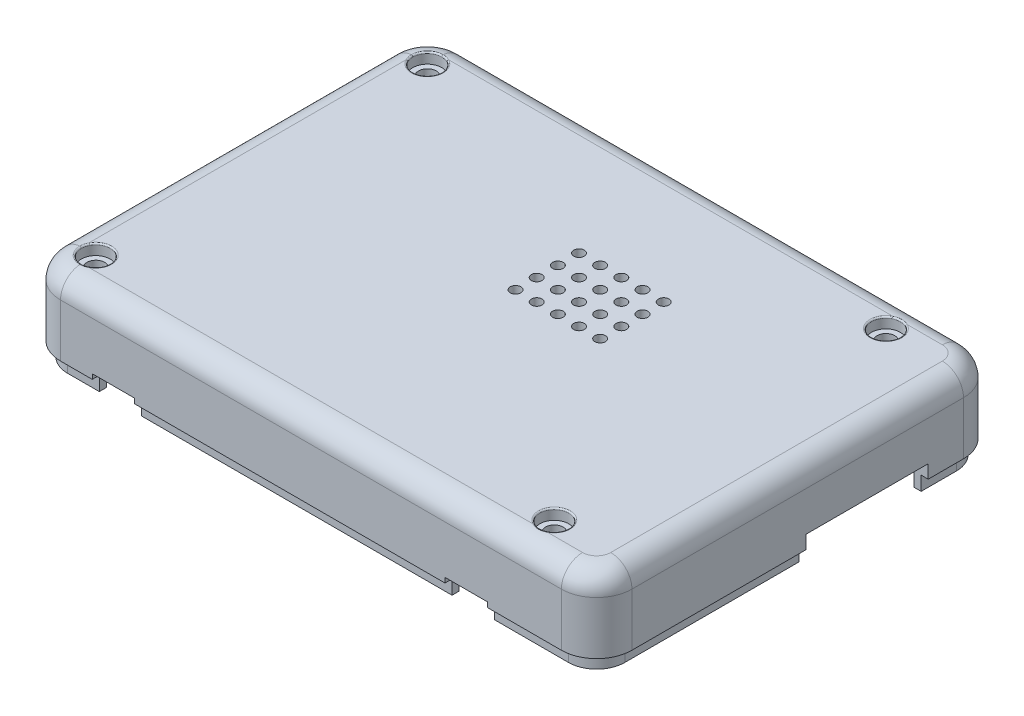
from build123d import *

# Parameters (mm, degrees)
SKETCH_4_W          = 81
SKETCH_4_H          = 57
SKETCH_4_R          = 1.25
EXTRUDE_5_DEPTH     = 3
EXTRUDE_START       = -3
SKETCH_4_4_R        = 2.5
SKETCH_4_4_R_2      = 1.25
EXTRUDE_6_DEPTH     = 10.6
SKETCH_4_5_W        = 81
SKETCH_4_5_H        = 57
SKETCH_4_5_W_2      = 77
SKETCH_4_5_H_2      = 53
EXTRUDE_7_DEPTH     = 10.5
SKETCH_6_W          = 12.5
SKETCH_6_H          = 2.15
SKETCH_6_W_2        = 10
SKETCH_6_W_3        = 7.5
SKETCH_6_H_2        = 3.15
SKETCH_6_W_4        = 9
SKETCH_6_H_3        = 0.5
CUT_EXTRUDE_1_DEPTH = 2
SKETCH_7_W          = 10.9
SKETCH_7_H          = 1.2
SKETCH_7_W_2        = 8.95
SKETCH_7_H_2        = 7.5
CUT_EXTRUDE_2_DEPTH = 2
SKETCH_8_W          = 6
SKETCH_8_H          = 0.7
CUT_EXTRUDE_3_DEPTH = 2
SKETCH_9_W          = 17.3
SKETCH_9_H          = 1.9
CUT_EXTRUDE_4_DEPTH = 2
FILLET_2_R          = 3
FILLET_3_R          = 5
FILLET_4_R          = 3
FILLET_5_R          = 2
FILLET_6_R          = 3.5
SKETCH_10_R         = 2.05
CUT_EXTRUDE_5_DEPTH = 1.5
FILLET_7_R          = 0.2
EXTRUDE_START_2     = 2
SKETCH_12_W         = 3.4
SKETCH_12_H         = 1
SKETCH_12_W_2       = 4
SKETCH_12_W_3       = 7
SKETCH_12_W_4       = 1
SKETCH_12_H_2       = 17.85
SKETCH_12_W_5       = 44
EXTRUDE_9_DEPTH     = 2
SKETCH_13_R         = 0.75
CUT_EXTRUDE_6_DEPTH = 3


# Some blends are built 0.0001 mm under size
with BuildPart() as part:
    # 草图4 → 凸台-拉伸5 (new body)
    with BuildSketch(Plane(origin=(0, 0, 0), x_dir=(1, 0, 0), z_dir=(0, 1, 0))):
        with Locations((-80.045972017, 113.056664423)):
            Rectangle(SKETCH_4_W, SKETCH_4_H)
        with Locations(Location((-115.545972017, 136.556664423, 0), (0, 0, 270))):
            Circle(SKETCH_4_R, mode=Mode.SUBTRACT)
        with Locations(Location((-50.545972017, 136.556664423, 0), (0, 0, 270))):
            Circle(SKETCH_4_R, mode=Mode.SUBTRACT)
        with Locations(Location((-50.545972017, 89.556664423, 0), (0, 0, 270))):
            Circle(SKETCH_4_R, mode=Mode.SUBTRACT)
        with Locations(Location((-115.545972017, 89.556664423, 0), (0, 0, 270))):
            Circle(SKETCH_4_R, mode=Mode.SUBTRACT)
    extrude(amount=-EXTRUDE_5_DEPTH)

    # 草图4<4> → 凸台-拉伸6 (add)
    # profile 1 of 4: a face of its own
    with BuildSketch(Plane(origin=(0, 0, 0), x_dir=(1, 0, 0), z_dir=(0, 1, 0)).offset(EXTRUDE_START)):
        with Locations(Location((-50.545972017, 89.556664423, 0), (0, 0, 90))):
            Circle(SKETCH_4_4_R)
        with Locations(Location((-50.545972017, 89.556664423, 0), (0, 0, 270))):
            Circle(SKETCH_4_4_R_2, mode=Mode.SUBTRACT)
    # profile 2 of 4: a face of its own
    with BuildSketch(Plane(origin=(0, 0, 0), x_dir=(1, 0, 0), z_dir=(0, 1, 0)).offset(EXTRUDE_START)):
        with Locations(Location((-115.545972017, 89.556664423, 0), (0, 0, 90))):
            Circle(SKETCH_4_4_R)
        with Locations(Location((-115.545972017, 89.556664423, 0), (0, 0, 270))):
            Circle(SKETCH_4_4_R_2, mode=Mode.SUBTRACT)
    # profile 3 of 4: a face of its own
    with BuildSketch(Plane(origin=(0, 0, 0), x_dir=(1, 0, 0), z_dir=(0, 1, 0)).offset(EXTRUDE_START)):
        with Locations(Location((-50.545972017, 136.556664423, 0), (0, 0, 90))):
            Circle(SKETCH_4_4_R)
        with Locations(Location((-50.545972017, 136.556664423, 0), (0, 0, 270))):
            Circle(SKETCH_4_4_R_2, mode=Mode.SUBTRACT)
    # profile 4 of 4: a face of its own
    with BuildSketch(Plane(origin=(0, 0, 0), x_dir=(1, 0, 0), z_dir=(0, 1, 0)).offset(EXTRUDE_START)):
        with Locations(Location((-115.545972017, 136.556664423, 0), (0, 0, 90))):
            Circle(SKETCH_4_4_R)
        with Locations(Location((-115.545972017, 136.556664423, 0), (0, 0, 270))):
            Circle(SKETCH_4_4_R_2, mode=Mode.SUBTRACT)
    extrude(amount=-EXTRUDE_6_DEPTH)

    # 草图4<5> → 凸台-拉伸7 (add)
    with BuildSketch(Plane(origin=(0, 0, 0), x_dir=(1, 0, 0), z_dir=(0, 1, 0))):
        with Locations((-80.045972017, 113.056664423)):
            Rectangle(SKETCH_4_5_W, SKETCH_4_5_H)
        with Locations((-80.045972017, 113.056664423)):
            Rectangle(SKETCH_4_5_W_2, SKETCH_4_5_H_2, mode=Mode.SUBTRACT)
    extrude(amount=-EXTRUDE_7_DEPTH)

    # 草图6 → 切除-拉伸1 (cut)
    with BuildSketch(Plane(origin=(0, 0, -141.556664423), x_dir=(-1, 0, 0), z_dir=(0, 0, -1))):
        with Locations((65.795972017, -9.425)):
            Rectangle(SKETCH_6_W, SKETCH_6_H)
        with Locations((80.445972017, -9.425)):
            Rectangle(SKETCH_6_W_2, SKETCH_6_H)
        with Locations((93.195972017, -8.925)):
            Rectangle(SKETCH_6_W_3, SKETCH_6_H_2)
        with Locations((108.445972017, -10.25)):
            Rectangle(SKETCH_6_W_4, SKETCH_6_H_3)
    extrude(amount=-CUT_EXTRUDE_1_DEPTH, mode=Mode.SUBTRACT)

    # 草图7 → 切除-拉伸2 (cut)
    with BuildSketch(Plane.ZY.offset(120.545972017)):
        with Locations((-101.006664423, -9.9)):
            Rectangle(SKETCH_7_W, SKETCH_7_H)
        with Locations((-128.781664423, -6.75)):
            Rectangle(SKETCH_7_W_2, SKETCH_7_H_2)
    extrude(amount=-CUT_EXTRUDE_2_DEPTH, mode=Mode.SUBTRACT)

    # 草图8 → 切除-拉伸3 (cut)
    with BuildSketch(Plane.XY.offset(-84.556664423)):
        with Locations((-108.045972017, -10.15)):
            Rectangle(SKETCH_8_W, SKETCH_8_H)
        with Locations((-58.045972017, -10.15)):
            Rectangle(SKETCH_8_W, SKETCH_8_H)
    extrude(amount=-CUT_EXTRUDE_3_DEPTH, mode=Mode.SUBTRACT)

    # 草图9 → 切除-拉伸4 (cut)
    with BuildSketch(Plane(origin=(-39.545972017, 0, 0), x_dir=(0, 0, -1), z_dir=(1, 0, 0))):
        with Locations((122.906664423, -9.55)):
            Rectangle(SKETCH_9_W, SKETCH_9_H)
    extrude(amount=-CUT_EXTRUDE_4_DEPTH, mode=Mode.SUBTRACT)

    # 圆角2
    fillet_2_edges = [part.edges().sort_by_distance(p)[0] for p in [
        (-41.545972017, -6.75, -139.556664423),
        (-118.545972017, -6.75, -139.556664423),
        (-118.545972017, -6.75, -86.556664423),
        (-41.545972017, -6.75, -86.556664423),
    ]]
    fillet(fillet_2_edges, radius=FILLET_2_R)

    # 圆角3
    fillet_3_edges = [part.edges().sort_by_distance(p)[0] for p in [
        (-120.545972017, -5.25, -141.556664423),
        (-120.545972017, -5.25, -84.556664423),
        (-39.545972017, -5.25, -84.556664423),
        (-39.545972017, -5.25, -141.556664423),
    ]]
    fillet(fillet_3_edges, radius=FILLET_3_R)

    # 圆角4
    fillet_4_edges = [part.edges().sort_by_distance(p)[0] for p in [
        (-120.545972017, 0, -113.056664423),
        (-80.045972017, 0, -141.556664423),
        (-80.045972017, 0, -84.556664423),
        (-39.545972017, 0, -113.056664423),
        (-119.081505923, 0, -140.092198329),
        (-41.010438111, 0, -140.092198329),
        (-41.010438111, 0, -86.021130517),
        (-119.081505923, 0, -86.021130517),
    ]]
    fillet(fillet_4_edges, radius=FILLET_4_R - 0.0001)  # a hair under: the kernel refuses the full size

    # 圆角5
    # the kernel refuses this fillet: 2 mm, written as the material it adds along each edge
    with BuildSketch(Plane(origin=(-120.545972017, -9.3, -95.556664423), x_dir=(0, -1, 0), z_dir=(1, 0, 0))) as fillet_5_piece_1:
        with BuildLine():
            CenterArc((2, 1.833030278), FILLET_5_R, 180, 66.421821522)
            Line((0, 1.833030278), (-0.04, 1.833030278))
            Line((-0.04, 1.833030278), (-0.04, 0))
            Line((-0.04, 0), (0, -0.04))
            ThreePointArc((0, -0.04), (0.6, -0.04), (1.184, -0.036660606))
            Line((1.184, -0.036660606), (1.2, 0))
        make_face()
    extrude(amount=2)
    with BuildSketch(Plane(origin=(-120.545972017, -9.3, -106.456664423), x_dir=(0, 0, 1), z_dir=(1, 0, 0))) as fillet_5_piece_2:
        with BuildLine():
            CenterArc((1.833030278, 2), FILLET_5_R, 203.578178478, 66.421821522)
            Line((0, 1.2), (-0.036660606, 1.184))
            ThreePointArc((-0.036660606, 1.184), (-0.04, 0.6), (-0.04, 0))
            Line((-0.04, 0), (0, -0.04))
            Line((0, -0.04), (1.833030278, -0.04))
            Line((1.833030278, -0.04), (1.833030278, 0))
        make_face()
    extrude(amount=2)

    # 圆角6
    fillet_6_edges = [part.edges().sort_by_distance(p)[0] for p in [
        (-119.545972017, -3, -124.306664423),
        (-119.545972017, -3, -133.256664423),
    ]]
    fillet(fillet_6_edges, radius=FILLET_6_R)

    # 草图10 → 切除-拉伸5 (cut)
    with BuildSketch(Plane(origin=(0, 0, 0), x_dir=(1, 0, 0), z_dir=(0, 1, 0))):
        with Locations(Location((-50.545972017, 89.556664423, 0), (0, 0, 270))):
            Circle(SKETCH_10_R)
        with Locations(Location((-115.545972017, 89.556664423, 0), (0, 0, 269.99999999))):
            Circle(SKETCH_10_R)
        with Locations(Location((-115.545972017, 136.556664423, 0), (0, 0, 270))):
            Circle(SKETCH_10_R)
        with Locations(Location((-50.545972017, 136.556664423, 0), (0, 0, 270))):
            Circle(SKETCH_10_R)
    extrude(amount=-CUT_EXTRUDE_5_DEPTH, mode=Mode.SUBTRACT)

    # 圆角7
    fillet_7_edges = [part.edges().sort_by_distance(p)[0] for p in [
        (-50.319813864, -0.000232982, -87.519177621),
        (-50.545972017, 0, -91.606664423),
        (-116.995540918, -0.000415044, -88.107095521),
        (-117.583458819, -0.000232982, -136.33050627),
        (-50.545972017, -0.000415044, -138.606664423),
        (-117.583458821, -0.000232981, -89.782822576),
        (-115.319813864, -0.000232982, -87.519177621),
        (-114.096403115, 0, -91.006233324),
        (-115.319813864, -0.000232981, -138.594151227),
        (-116.995540918, -0.000415044, -138.006233324),
        (-113.508485207, 0, -136.330506292),
        (-48.508485207, 0, -136.330506292),
    ]]
    fillet(fillet_7_edges, radius=FILLET_7_R)

    # 草图12 → 凸台-拉伸9 (add)
    with BuildSketch(Plane.XZ.offset(10.5).offset(EXTRUDE_START_2)):
        with BuildLine():
            ThreePointArc((-40.545972017, -89.556664423), (-41.717544892, -86.728237298), (-44.545972017, -85.556664423))
            Line((-44.545972017, -85.556664423), (-55.045972017, -85.556664423))
            Line((-55.045972017, -85.556664423), (-55.045972017, -86.556664423))
            Line((-55.045972017, -86.556664423), (-44.545972017, -86.556664423))
            ThreePointArc((-44.545972017, -86.556664423), (-42.424651673, -87.435344079), (-41.545972017, -89.556664423))
            Line((-41.545972017, -89.556664423), (-41.545972017, -114.256664423))
            Line((-41.545972017, -114.256664423), (-40.545972017, -114.256664423))
            Line((-40.545972017, -114.256664423), (-40.545972017, -89.556664423))
        make_face()
        with BuildLine():
            Line((-40.545972017, -136.556664423), (-40.545972017, -131.556664423))
            Line((-40.545972017, -131.556664423), (-41.545972017, -131.556664423))
            Line((-41.545972017, -131.556664423), (-41.545972017, -136.556664423))
            ThreePointArc((-41.545972017, -136.556664423), (-42.424651673, -138.677984766), (-44.545972017, -139.556664423))
            Line((-44.545972017, -139.556664423), (-59.545972017, -139.556664423))
            Line((-59.545972017, -139.556664423), (-59.545972017, -140.556664423))
            Line((-59.545972017, -140.556664423), (-44.545972017, -140.556664423))
            ThreePointArc((-44.545972017, -140.556664423), (-41.717544892, -139.385091548), (-40.545972017, -136.556664423))
        make_face()
        with Locations((-73.745972017, -140.056664423)):
            Rectangle(SKETCH_12_W, SKETCH_12_H)
        with Locations((-87.445972017, -140.056664423)):
            Rectangle(SKETCH_12_W_2, SKETCH_12_H)
        with Locations((-100.445972017, -140.056664423)):
            Rectangle(SKETCH_12_W_3, SKETCH_12_H)
        with BuildLine():
            Line((-118.545972017, -133.256664423), (-119.545972017, -133.256664423))
            Line((-119.545972017, -133.256664423), (-119.545972017, -136.556664423))
            ThreePointArc((-119.545972017, -136.556664423), (-118.374399142, -139.385091548), (-115.545972017, -140.556664423))
            Line((-115.545972017, -140.556664423), (-112.945972017, -140.556664423))
            Line((-112.945972017, -140.556664423), (-112.945972017, -139.556664423))
            Line((-112.945972017, -139.556664423), (-115.545972017, -139.556664423))
            ThreePointArc((-115.545972017, -139.556664423), (-117.66729236, -138.677984766), (-118.545972017, -136.556664423))
            Line((-118.545972017, -136.556664423), (-118.545972017, -133.256664423))
        make_face()
        with Locations((-119.045972017, -115.381664423)):
            Rectangle(SKETCH_12_W_4, SKETCH_12_H_2)
        with BuildLine():
            Line((-111.045972017, -86.556664423), (-111.045972017, -85.556664423))
            Line((-111.045972017, -85.556664423), (-115.545972017, -85.556664423))
            ThreePointArc((-115.545972017, -85.556664423), (-118.374399142, -86.728237298), (-119.545972017, -89.556664423))
            Line((-119.545972017, -89.556664423), (-119.545972017, -95.556664423))
            Line((-119.545972017, -95.556664423), (-118.545972017, -95.556664423))
            Line((-118.545972017, -95.556664423), (-118.545972017, -89.556664423))
            ThreePointArc((-118.545972017, -89.556664423), (-117.66729236, -87.435344079), (-115.545972017, -86.556664423))
            Line((-115.545972017, -86.556664423), (-111.045972017, -86.556664423))
        make_face()
        with Locations((-83.045972017, -86.056664423)):
            Rectangle(SKETCH_12_W_5, SKETCH_12_H)
    extrude(amount=-EXTRUDE_9_DEPTH)

    # 草图13 → 切除-拉伸6 (cut)
    with BuildSketch(Plane(origin=(0, 0, 0), x_dir=(1, 0, 0), z_dir=(0, 1, 0))):
        with Locations(Location((-69.545972017, 115.056664423, 0), (0, 0, 270))):
            Circle(SKETCH_13_R)
        with Locations(Location((-72.545972017, 115.056664423, 0), (0, 0, 270))):
            Circle(SKETCH_13_R)
        with Locations(Location((-75.545972017, 115.056664423, 0), (0, 0, 270))):
            Circle(SKETCH_13_R)
        with Locations(Location((-78.545972017, 115.056664423, 0), (0, 0, 270))):
            Circle(SKETCH_13_R)
        with Locations(Location((-81.545972017, 115.056664423, 0), (0, 0, 270))):
            Circle(SKETCH_13_R)
        with Locations(Location((-72.545972017, 118.056664423, 0), (0, 0, 270))):
            Circle(SKETCH_13_R)
        with Locations(Location((-75.545972017, 118.056664423, 0), (0, 0, 270))):
            Circle(SKETCH_13_R)
        with Locations(Location((-78.545972017, 118.056664423, 0), (0, 0, 270))):
            Circle(SKETCH_13_R)
        with Locations(Location((-81.545972017, 118.056664423, 0), (0, 0, 270))):
            Circle(SKETCH_13_R)
        with Locations(Location((-72.545972017, 121.056664423, 0), (0, 0, 270))):
            Circle(SKETCH_13_R)
        with Locations(Location((-75.545972017, 121.056664423, 0), (0, 0, 270))):
            Circle(SKETCH_13_R)
        with Locations(Location((-78.545972017, 121.056664423, 0), (0, 0, 270))):
            Circle(SKETCH_13_R)
        with Locations(Location((-81.545972017, 121.056664423, 0), (0, 0, 270))):
            Circle(SKETCH_13_R)
        with Locations(Location((-72.545972017, 124.056664423, 0), (0, 0, 270))):
            Circle(SKETCH_13_R)
        with Locations(Location((-75.545972017, 124.056664423, 0), (0, 0, 270))):
            Circle(SKETCH_13_R)
        with Locations(Location((-78.545972017, 124.056664423, 0), (0, 0, 270))):
            Circle(SKETCH_13_R)
        with Locations(Location((-81.545972017, 124.056664423, 0), (0, 0, 270))):
            Circle(SKETCH_13_R)
        with Locations(Location((-69.545972017, 118.056664423, 0), (0, 0, 270))):
            Circle(SKETCH_13_R)
        with Locations(Location((-69.545972017, 121.056664423, 0), (0, 0, 270))):
            Circle(SKETCH_13_R)
        with Locations(Location((-69.545972017, 124.056664423, 0), (0, 0, 270))):
            Circle(SKETCH_13_R)
    extrude(amount=-CUT_EXTRUDE_6_DEPTH, mode=Mode.SUBTRACT)


solid = part.part
